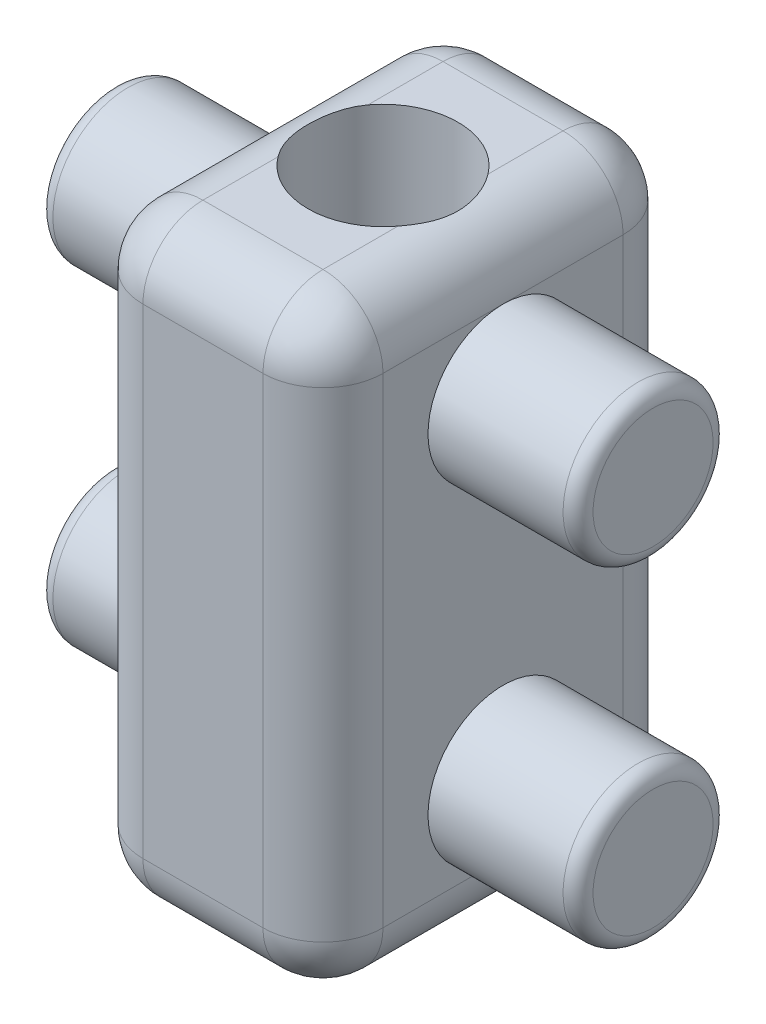
from build123d import *

# Parameters (mm, degrees)
SKETCH1_W           = 15.24
SKETCH1_H           = 25.4
BOSS_EXTRUDE1_DEPTH = 5.08
FILLET1_R           = 2.54
SKETCH2_R           = 3.175
BOSS_EXTRUDE2_DEPTH = 6.35
SKETCH3_W           = 5.08
SKETCH3_H           = 10.16
BOSS_EXTRUDE3_DEPTH = 5.08
SKETCH4_W           = 7.62
SKETCH4_H           = 12.7
BOSS_EXTRUDE4_DEPTH = 25.4
FILLET2_R           = 2.54
FILLET3_R           = 3.81
SKETCH5_R           = 1.905
BOSS_EXTRUDE5_DEPTH = 1.27
BOSS_EXTRUDE6_DEPTH = 25.4
FILLET4_R           = 1.27
SKETCH7_W           = 5.588
SKETCH7_H           = 21.59
CUT_EXTRUDE1_DEPTH  = 1.016
FILLET5_R           = 0.254
CUT_EXTRUDE2_REACH  = 52.512
SKETCH8_R           = 4.445
FILLET6_R           = 0.635
SKETCH9_W           = 25.4
SKETCH9_H           = 50.8
CUT_EXTRUDE3_DEPTH  = 22.86
SKETCH10_R          = 3.175
CUT_EXTRUDE4_DEPTH  = 12.7


# Some blends are built 0.0001 mm under size
with BuildPart() as part:
    # Sketch1 → Boss-Extrude1 (new, symmetric)
    with BuildSketch(Plane(origin=(0, 0, 0), x_dir=(0, 0, -1), z_dir=(1, 0, 0))):
        Rectangle(SKETCH1_W, SKETCH1_H)
    extrude(amount=BOSS_EXTRUDE1_DEPTH, both=True)

    # Fillet1
    fillet1_edges = [part.edges().sort_by_distance(p)[0] for p in [
        (5.08, 0, 7.62),
        (5.08, -12.7, 0),
        (5.08, 0, -7.62),
        (-5.08, -12.7, 0),
        (-5.08, 0, 7.62),
        (-5.08, 12.7, 0),
        (-5.08, 0, -7.62),
        (5.08, 12.7, 0),
        (0, -12.7, -7.62),
        (0, -12.7, 7.62),
        (0, 12.7, 7.62),
        (0, 12.7, -7.62),
    ]]
    fillet(fillet1_edges, radius=FILLET1_R)

    # Sketch2 → Boss-Extrude2 (add)
    with BuildSketch(Plane(origin=(5.08, 0, 0), x_dir=(0, 0, -1), z_dir=(1, 0, 0))):
        with Locations(Location((0, 6.985, 0), (0, 0, 90))):
            Circle(SKETCH2_R)
        with Locations(Location((0, -6.985, 0), (0, 0, 270))):
            Circle(SKETCH2_R)
    boss_extrude2 = extrude(amount=BOSS_EXTRUDE2_DEPTH)

    # Mirror1: Boss-Extrude2 across plane
    add(boss_extrude2.mirror(Plane(origin=(0, 0, 0), x_dir=(0, 0, 1), z_dir=(1, 0, 0))))

    # Sketch3 → Boss-Extrude3 (add)
    with BuildSketch(Plane(origin=(0, 12.7, 0), x_dir=(1, 0, 0), z_dir=(0, 1, 0))):
        Rectangle(SKETCH3_W, SKETCH3_H)
    extrude(amount=BOSS_EXTRUDE3_DEPTH)

    # Sketch4 → Boss-Extrude4 (add)
    with BuildSketch(Plane(origin=(0, 17.78, 0), x_dir=(1, 0, 0), z_dir=(0, 1, 0))):
        Rectangle(SKETCH4_W, SKETCH4_H)
    extrude(amount=BOSS_EXTRUDE4_DEPTH)

    # Fillet2
    # the kernel refuses this fillet: 2.54 mm, written as the material it takes off along each edge
    with BuildSketch(Plane(origin=(10.16, 17.78, -6.35), x_dir=(0, 0, 1), z_dir=(-1, 0, 0))) as fillet2_piece_1_section:
        with BuildLine():
            CenterArc((FILLET2_R, FILLET2_R), FILLET2_R, 180, 90)
            Line((0, FILLET2_R), (0, 0))
            Line((0, 0), (FILLET2_R, 0))
        make_face()
    fillet2_piece_1 = extrude(amount=20.32, mode=Mode.PRIVATE)
    fillet2_piece_1 = split(fillet2_piece_1, bisect_by=Plane(origin=(6.35, 17.840981289, -5.08), z_dir=(0, 0, 1)), keep=Keep.TOP, mode=Mode.PRIVATE)
    fillet2_piece_1 = split(fillet2_piece_1, bisect_by=Plane(origin=(2.54, 17.840981289, -4.665343007), z_dir=(1, 0, 0)), keep=Keep.TOP, mode=Mode.PRIVATE)
    add(fillet2_piece_1, mode=Mode.SUBTRACT)
    with BuildSketch(Plane(origin=(10.16, 17.78, -6.35), x_dir=(0, 0, 1), z_dir=(-1, 0, 0))) as fillet2_piece_2_section:
        with BuildLine():
            CenterArc((FILLET2_R, FILLET2_R), FILLET2_R, 180, 90)
            Line((0, FILLET2_R), (0, 0))
            Line((0, 0), (FILLET2_R, 0))
        make_face()
    fillet2_piece_2 = extrude(amount=20.32, mode=Mode.PRIVATE)
    fillet2_piece_2 = split(fillet2_piece_2, bisect_by=Plane(origin=(6.35, 18.428004952, -5.08), z_dir=(0, 0, -1)), keep=Keep.TOP, mode=Mode.PRIVATE)
    fillet2_piece_2 = split(fillet2_piece_2, bisect_by=Plane(origin=(2.54, 18.428004952, -5.932444919), z_dir=(1, 0, 0)), keep=Keep.TOP, mode=Mode.PRIVATE)
    add(fillet2_piece_2, mode=Mode.SUBTRACT)
    with BuildSketch(Plane(origin=(10.16, 17.78, -6.35), x_dir=(0, 0, 1), z_dir=(-1, 0, 0))) as fillet2_piece_3_section:
        with BuildLine():
            CenterArc((FILLET2_R, FILLET2_R), FILLET2_R, 180, 90)
            Line((0, FILLET2_R), (0, 0))
            Line((0, 0), (FILLET2_R, 0))
        make_face()
    fillet2_piece_3 = extrude(amount=20.32, mode=Mode.PRIVATE)
    fillet2_piece_3 = split(fillet2_piece_3, bisect_by=Plane(origin=(0, 18.428004952, -5.08), z_dir=(0, 0, -1)), keep=Keep.TOP, mode=Mode.PRIVATE)
    fillet2_piece_3 = split(fillet2_piece_3, bisect_by=Plane(origin=(-2.54, 18.428004952, -5.932444919), z_dir=(1, 0, 0)), keep=Keep.TOP, mode=Mode.PRIVATE)
    fillet2_piece_3 = split(fillet2_piece_3, bisect_by=Plane(origin=(2.54, 18.428004952, -5.932444919), z_dir=(-1, 0, 0)), keep=Keep.TOP, mode=Mode.PRIVATE)
    add(fillet2_piece_3, mode=Mode.SUBTRACT)
    with BuildSketch(Plane(origin=(10.16, 17.78, -6.35), x_dir=(0, 0, 1), z_dir=(-1, 0, 0))) as fillet2_piece_4_section:
        with BuildLine():
            CenterArc((FILLET2_R, FILLET2_R), FILLET2_R, 180, 90)
            Line((0, FILLET2_R), (0, 0))
            Line((0, 0), (FILLET2_R, 0))
        make_face()
    fillet2_piece_4 = extrude(amount=20.32, mode=Mode.PRIVATE)
    fillet2_piece_4 = split(fillet2_piece_4, bisect_by=Plane(origin=(-6.35, 17.840981289, -5.08), z_dir=(0, 0, 1)), keep=Keep.TOP, mode=Mode.PRIVATE)
    fillet2_piece_4 = split(fillet2_piece_4, bisect_by=Plane(origin=(-2.54, 17.840981289, -4.665343007), z_dir=(-1, 0, 0)), keep=Keep.TOP, mode=Mode.PRIVATE)
    add(fillet2_piece_4, mode=Mode.SUBTRACT)
    with BuildSketch(Plane(origin=(10.16, 17.78, -6.35), x_dir=(0, 0, 1), z_dir=(-1, 0, 0))) as fillet2_piece_5_section:
        with BuildLine():
            CenterArc((FILLET2_R, FILLET2_R), FILLET2_R, 180, 90)
            Line((0, FILLET2_R), (0, 0))
            Line((0, 0), (FILLET2_R, 0))
        make_face()
    fillet2_piece_5 = extrude(amount=20.32, mode=Mode.PRIVATE)
    fillet2_piece_5 = split(fillet2_piece_5, bisect_by=Plane(origin=(-6.35, 18.428004952, -5.08), z_dir=(0, 0, -1)), keep=Keep.TOP, mode=Mode.PRIVATE)
    fillet2_piece_5 = split(fillet2_piece_5, bisect_by=Plane(origin=(-2.54, 18.428004952, -5.932444919), z_dir=(-1, 0, 0)), keep=Keep.TOP, mode=Mode.PRIVATE)
    add(fillet2_piece_5, mode=Mode.SUBTRACT)
    with BuildSketch(Plane(origin=(-10.16, 17.78, 6.35), x_dir=(0, 1, 0), z_dir=(1, 0, 0))) as fillet2_piece_6_section:
        with BuildLine():
            CenterArc((FILLET2_R, -FILLET2_R), FILLET2_R, 90, 90)
            Line((0, -FILLET2_R), (0, 0))
            Line((0, 0), (FILLET2_R, 0))
        make_face()
    fillet2_piece_6 = extrude(amount=20.32, mode=Mode.PRIVATE)
    fillet2_piece_6 = split(fillet2_piece_6, bisect_by=Plane(origin=(-2.54, 18.428004952, 5.932444919), z_dir=(-1, 0, 0)), keep=Keep.TOP, mode=Mode.PRIVATE)
    fillet2_piece_6 = split(fillet2_piece_6, bisect_by=Plane(origin=(-6.35, 18.428004952, 5.08), z_dir=(0, 0, 1)), keep=Keep.TOP, mode=Mode.PRIVATE)
    add(fillet2_piece_6, mode=Mode.SUBTRACT)
    with BuildSketch(Plane(origin=(-10.16, 17.78, 6.35), x_dir=(0, 1, 0), z_dir=(1, 0, 0))) as fillet2_piece_7_section:
        with BuildLine():
            CenterArc((FILLET2_R, -FILLET2_R), FILLET2_R, 90, 90)
            Line((0, -FILLET2_R), (0, 0))
            Line((0, 0), (FILLET2_R, 0))
        make_face()
    fillet2_piece_7 = extrude(amount=20.32, mode=Mode.PRIVATE)
    fillet2_piece_7 = split(fillet2_piece_7, bisect_by=Plane(origin=(-2.54, 17.840981289, 4.665343007), z_dir=(-1, 0, 0)), keep=Keep.TOP, mode=Mode.PRIVATE)
    fillet2_piece_7 = split(fillet2_piece_7, bisect_by=Plane(origin=(-6.35, 17.840981289, 5.08), z_dir=(0, 0, -1)), keep=Keep.TOP, mode=Mode.PRIVATE)
    add(fillet2_piece_7, mode=Mode.SUBTRACT)
    with BuildSketch(Plane(origin=(-10.16, 17.78, 6.35), x_dir=(0, 1, 0), z_dir=(1, 0, 0))) as fillet2_piece_8_section:
        with BuildLine():
            CenterArc((FILLET2_R, -FILLET2_R), FILLET2_R, 90, 90)
            Line((0, -FILLET2_R), (0, 0))
            Line((0, 0), (FILLET2_R, 0))
        make_face()
    fillet2_piece_8 = extrude(amount=20.32, mode=Mode.PRIVATE)
    fillet2_piece_8 = split(fillet2_piece_8, bisect_by=Plane(origin=(-2.54, 18.428004952, 5.932444919), z_dir=(1, 0, 0)), keep=Keep.TOP, mode=Mode.PRIVATE)
    fillet2_piece_8 = split(fillet2_piece_8, bisect_by=Plane(origin=(0, 18.428004952, 5.08), z_dir=(0, 0, 1)), keep=Keep.TOP, mode=Mode.PRIVATE)
    fillet2_piece_8 = split(fillet2_piece_8, bisect_by=Plane(origin=(2.54, 18.428004952, 5.932444919), z_dir=(-1, 0, 0)), keep=Keep.TOP, mode=Mode.PRIVATE)
    add(fillet2_piece_8, mode=Mode.SUBTRACT)
    with BuildSketch(Plane(origin=(-10.16, 17.78, 6.35), x_dir=(0, 1, 0), z_dir=(1, 0, 0))) as fillet2_piece_9_section:
        with BuildLine():
            CenterArc((FILLET2_R, -FILLET2_R), FILLET2_R, 90, 90)
            Line((0, -FILLET2_R), (0, 0))
            Line((0, 0), (FILLET2_R, 0))
        make_face()
    fillet2_piece_9 = extrude(amount=20.32, mode=Mode.PRIVATE)
    fillet2_piece_9 = split(fillet2_piece_9, bisect_by=Plane(origin=(6.35, 18.428004952, 5.08), z_dir=(0, 0, 1)), keep=Keep.TOP, mode=Mode.PRIVATE)
    fillet2_piece_9 = split(fillet2_piece_9, bisect_by=Plane(origin=(2.54, 18.428004952, 5.932444919), z_dir=(1, 0, 0)), keep=Keep.TOP, mode=Mode.PRIVATE)
    add(fillet2_piece_9, mode=Mode.SUBTRACT)
    with BuildSketch(Plane(origin=(-10.16, 17.78, 6.35), x_dir=(0, 1, 0), z_dir=(1, 0, 0))) as fillet2_piece_10_section:
        with BuildLine():
            CenterArc((FILLET2_R, -FILLET2_R), FILLET2_R, 90, 90)
            Line((0, -FILLET2_R), (0, 0))
            Line((0, 0), (FILLET2_R, 0))
        make_face()
    fillet2_piece_10 = extrude(amount=20.32, mode=Mode.PRIVATE)
    fillet2_piece_10 = split(fillet2_piece_10, bisect_by=Plane(origin=(6.35, 17.840981289, 5.08), z_dir=(0, 0, -1)), keep=Keep.TOP, mode=Mode.PRIVATE)
    fillet2_piece_10 = split(fillet2_piece_10, bisect_by=Plane(origin=(2.54, 17.840981289, 4.665343007), z_dir=(1, 0, 0)), keep=Keep.TOP, mode=Mode.PRIVATE)
    add(fillet2_piece_10, mode=Mode.SUBTRACT)

    # Fillet3
    fillet3_edges = [part.edges().sort_by_distance(p)[0] for p in [
        (3.81, 43.18, 0),
        (0, 43.18, -6.35),
        (-3.81, 43.18, 0),
        (0, 43.18, 6.35),
    ]]
    fillet(fillet3_edges, radius=FILLET3_R - 0.0001)  # a hair under: the kernel refuses the full size

    # Sketch5 → Boss-Extrude5 (add)
    with BuildSketch(Plane(origin=(0, 0, -6.35), x_dir=(-1, 0, 0), z_dir=(0, 0, -1))):
        with Locations(Location((0, 32.385, 0), (0, 0, 180))):
            Circle(SKETCH5_R)
        with Locations(Location((0, 25.4, 0), (0, 0, 180))):
            Circle(SKETCH5_R)
    extrude(amount=BOSS_EXTRUDE5_DEPTH)

    # Sketch6 → Boss-Extrude6 (add)
    with BuildSketch(Plane(origin=(0, 21.59, 0), x_dir=(1, 0, 0), z_dir=(0, 1, 0))):
        with BuildLine():
            Line((-3.81, 10.541), (3.81, 10.541))
            ThreePointArc((3.81, 10.541), (5.588, 8.763), (3.81, 6.985))
            Line((3.81, 6.985), (-3.81, 6.985))
            ThreePointArc((-3.81, 6.985), (-5.588, 8.763), (-3.81, 10.541))
        make_face()
    extrude(amount=BOSS_EXTRUDE6_DEPTH)

    # Fillet4
    fillet4_edges = [part.edges().sort_by_distance(p)[0] for p in [
        (0, 21.59, -6.985),
        (-5.588, 21.59, -8.763),
        (5.588, 21.59, -8.763),
        (0, 21.59, -10.541),
        (-5.588, 46.99, -8.763),
        (0, 46.99, -6.985),
        (5.588, 46.99, -8.763),
        (0, 46.99, -10.541),
    ]]
    fillet(fillet4_edges, radius=FILLET4_R)

    # Sketch7 → Cut-Extrude1 (cut)
    with BuildSketch(Plane(origin=(0, 0, -10.541), x_dir=(-1, 0, 0), z_dir=(0, 0, -1))):
        with Locations((0, 34.29)):
            Rectangle(SKETCH7_W, SKETCH7_H)
    extrude(amount=-CUT_EXTRUDE1_DEPTH, mode=Mode.SUBTRACT)

    # Fillet5
    fillet5_edges = [part.edges().sort_by_distance(p)[0] for p in [
        (-2.794, 34.29, -10.541),
        (0, 45.085, -10.541),
        (2.794, 34.29, -10.541),
        (0, 23.495, -10.541),
    ]]
    fillet(fillet5_edges, radius=FILLET5_R)

    # Sketch8 → Cut-Extrude2 (cut, up to next)
    with BuildSketch(Plane(origin=(3.81, 0, 0), x_dir=(0, 0, -1), z_dir=(1, 0, 0)), mode=Mode.PRIVATE) as cut_extrude2_sk1:
        with Locations((0, 33.02)):
            Circle(SKETCH8_R)
    cut_extrude2_tool1 = extrude(cut_extrude2_sk1.sketch, amount=-CUT_EXTRUDE2_REACH, mode=Mode.PRIVATE) & part.part
    add(cut_extrude2_tool1.solids().sort_by_distance((3.81, 33.02, 0))[0], mode=Mode.SUBTRACT)

    # Fillet6
    fillet6_edges = [part.edges().sort_by_distance(p)[0] for p in [
        (11.43, 3.81, 0),
        (11.43, -3.81, 0),
        (-11.43, 3.81, 0),
        (-11.43, -3.81, 0),
    ]]
    fillet(fillet6_edges, radius=FILLET6_R)

    # Sketch9 → Cut-Extrude3 (cut)
    with BuildSketch(Plane(origin=(11.43, 0, 0), x_dir=(0, 0, -1), z_dir=(1, 0, 0))):
        with Locations((0, 38.1)):
            Rectangle(SKETCH9_W, SKETCH9_H)
    extrude(amount=-CUT_EXTRUDE3_DEPTH, mode=Mode.SUBTRACT)

    # Sketch10 → Cut-Extrude4 (cut)
    with BuildSketch(Plane(origin=(0, 12.7, 0), x_dir=(1, 0, 0), z_dir=(0, 1, 0))):
        with Locations(Location((0, 0, 0), (0, 0, 270))):
            Circle(SKETCH10_R)
    extrude(amount=-CUT_EXTRUDE4_DEPTH, mode=Mode.SUBTRACT)


solid = part.part
